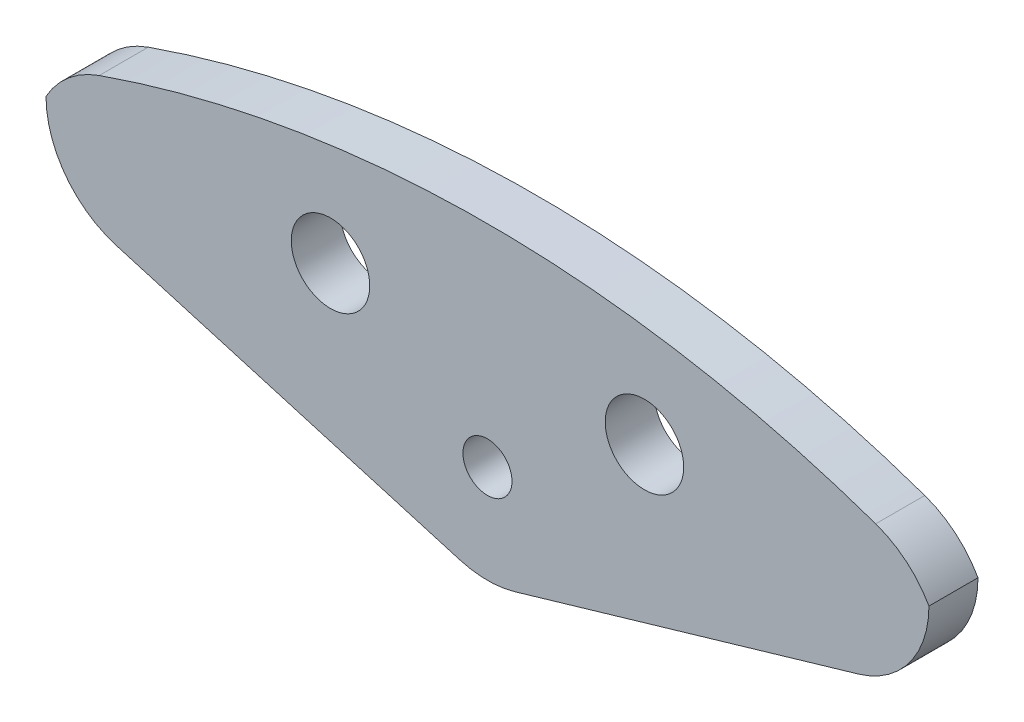
from build123d import *

# Parameters (mm, degrees)
SKETCH1_R           = 2.5
SKETCH1_R_2         = 4
BOSS_EXTRUDE1_DEPTH = 5
FILLET1_R           = 10
FILLET2_R           = 10


with BuildPart() as part:
    # Sketch1 → Boss-Extrude1 (new body)
    with BuildSketch(Plane.XY):
        with BuildLine():
            Line((45, 12.742977306), (45, 2.742977306))
            Line((45, 2.742977306), (2.807261435, -9.597879101))
            ThreePointArc((2.807261435, -9.597879101), (0, -10), (-2.807261435, -9.597879101))
            Line((-2.807261435, -9.597879101), (-45, 2.742977306))
            Line((-45, 2.742977306), (-45, 12.742977306))
            ThreePointArc((-45, 12.742977306), (0, 21.5), (45, 12.742977306))
        make_face()
        Circle(SKETCH1_R, mode=Mode.SUBTRACT)
        with Locations((16, 10)):
            Circle(SKETCH1_R_2, mode=Mode.SUBTRACT)
        with Locations((-16, 10)):
            Circle(SKETCH1_R_2, mode=Mode.SUBTRACT)
    extrude(amount=BOSS_EXTRUDE1_DEPTH)

    # Fillet1
    fillet1_edges = [part.edges().sort_by_distance(p)[0] for p in [
        (-45, 2.742977306, 2.5),
        (45, 2.742977306, 2.5),
    ]]
    fillet(fillet1_edges, radius=FILLET1_R)

    # Fillet2
    # the kernel refuses this fillet: 10 mm, written as the material it takes off along each edge
    with BuildSketch(Plane(origin=(45, 12.742977306, -14.490141462), x_dir=(0, -1, 0), z_dir=(0, 0, 1))) as fillet2_piece_1:
        with BuildLine():
            CenterArc((7.397382661, -8.722011181), FILLET2_R, 119.284560105, 41.458809305)
            Line((-2.043125943, -5.424012197), (-2.231936115, -5.358052218))
            ThreePointArc((-2.231936115, -5.358052218), (-1.241477696, -2.629168254), (-0.185404962, 0.075))
            Line((-0.185404962, 0.075), (0, 0.2))
            ThreePointArc((0, 0.2), (1.252954174, 0.2), (2.408078861, 0.174440224))
            Line((2.408078861, 0.174440224), (2.505908347, 0))
        make_face()
    extrude(amount=33.980282925, mode=Mode.SUBTRACT)
    with BuildSketch(Plane(origin=(-45, 12.742977306, -14.490141462), x_dir=(0.9358107737298137, 0.3525027599483545, 0), z_dir=(0, 0, 1))) as fillet2_piece_2:
        with BuildLine():
            CenterArc((5.554554227, -9.997083405), FILLET2_R, 88.616158877, 41.458809305)
            Line((-0.883339609, -2.34505603), (-1.012097485, -2.192015482))
            ThreePointArc((-1.012097485, -2.192015482), (-0.628831959, -1.102027463), (-0.187162155, 0.070500552))
            Line((-0.187162155, 0.070500552), (-0.004830047, 0.199941668))
            ThreePointArc((-0.004830047, 0.199941668), (2.898028292, 0.234999137), (5.800886632, 0.199941668))
            Line((5.800886632, 0.199941668), (5.796056585, 0))
        make_face()
    extrude(amount=33.980282925, mode=Mode.SUBTRACT)


solid = part.part
